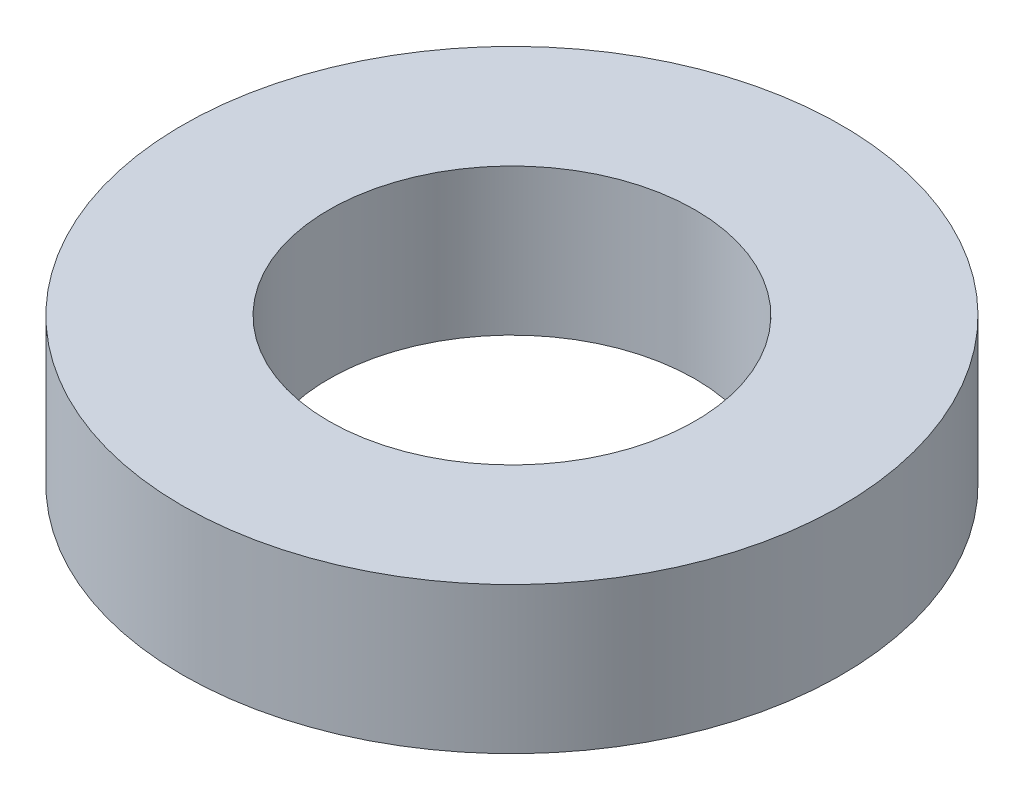
from build123d import *

# Parameters (mm, degrees)
SKETCH1_R           = 67.5
BOSS_EXTRUDE1_DEPTH = 30
SKETCH2_R           = 37.5
CUT_EXTRUDE1_DEPTH  = 101.062480481


with BuildPart() as part:
    # Sketch1 → Boss-Extrude1 (new body)
    with BuildSketch(Plane(origin=(0, 0, 0), x_dir=(1, 0, 0), z_dir=(0, 1, 0))):
        Circle(SKETCH1_R)
    extrude(amount=BOSS_EXTRUDE1_DEPTH)

    # Sketch2 → Cut-Extrude1 (cut, through all)
    with BuildSketch(Plane(origin=(0, 0, 0), x_dir=(1, 0, 0), z_dir=(0, 1, 0))):
        Circle(SKETCH2_R)
    extrude(amount=CUT_EXTRUDE1_DEPTH, mode=Mode.SUBTRACT)


solid = part.part
